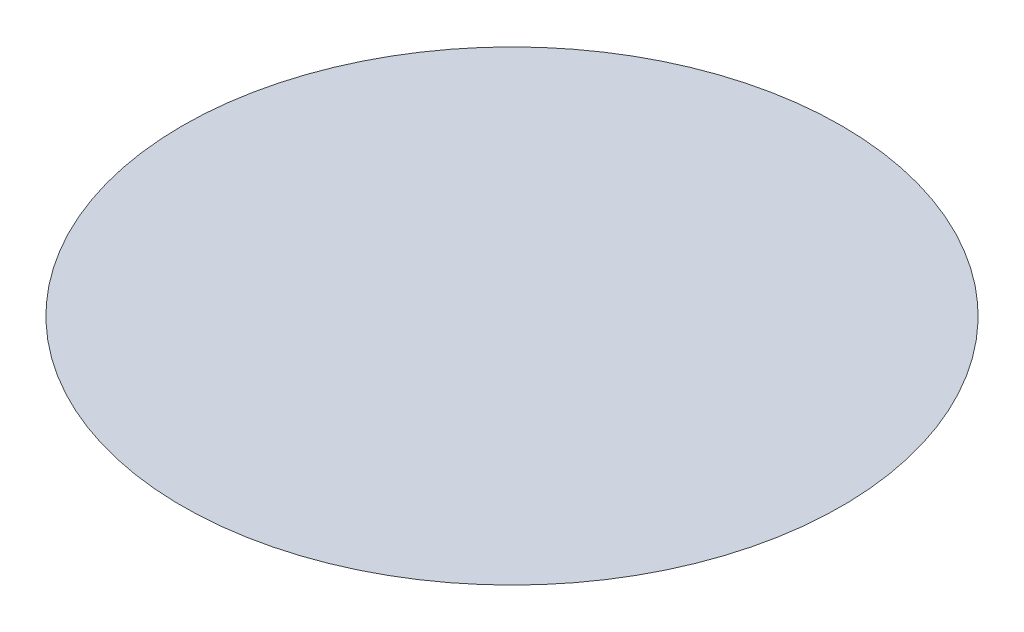
from build123d import *


with BuildPart() as part:
    # Sketch1 → Revolve1 (revolve)
    with BuildSketch(Plane.XY):
        with BuildLine():
            Line((0, 0), (0, 24.5))
            Line((0, 24.5), (95.92171287, 24.5))
            ThreePointArc((95.92171287, 24.5), (49.500568179, 6.221763765), (0, 0))
        make_face()
    revolve(axis=Axis((0, 0, 0), (0, 1, 0)))


solid = part.part
